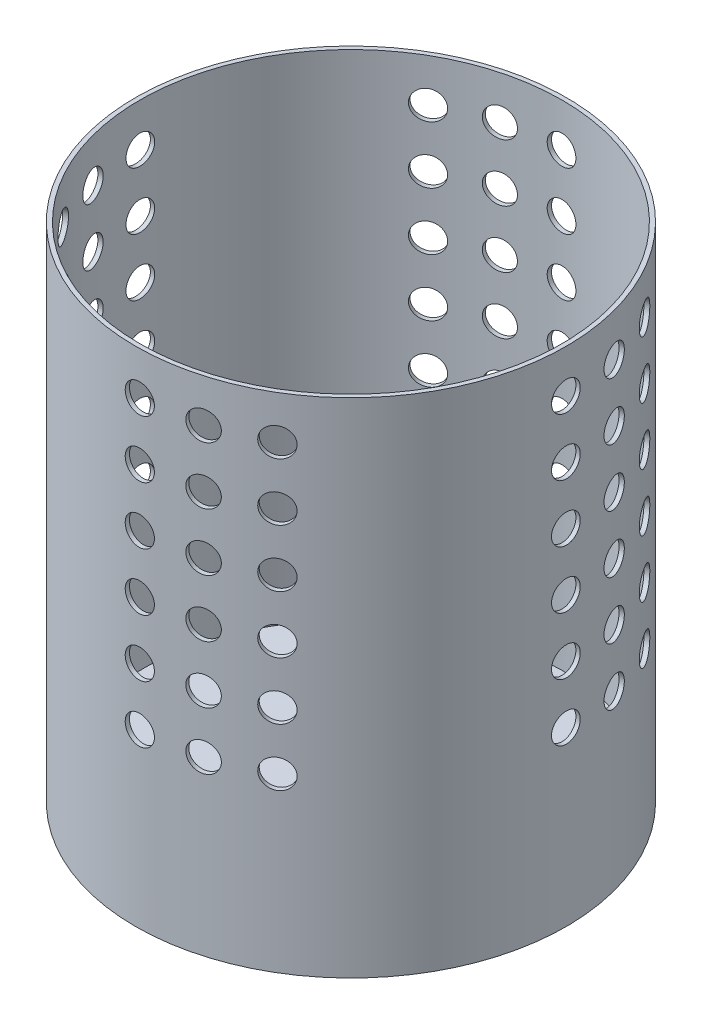
from build123d import *

# Parameters (mm, degrees)
SKETCH1_R                   = 75
BOSS_EXTRUDE1_DEPTH         = 175
SHELL1_T                    = -1.5
SKETCH2_R                   = 5
CUT_EXTRUDE1_DEPTH          = 175
SKETCH3_R                   = 5
CUT_EXTRUDE2_DEPTH          = 5
CIRPATTERN1_COUNT           = 3
CIRPATTERN1_ANGLE           = 30
CIRPATTERN2_COUNT           = 4
CIRPATTERN2_COPY_1_SKETCH_R = 5
CIRPATTERN2_COPY_1_DEPTH    = 5
CIRPATTERN2_COPY_2_SKETCH_R = 5
CIRPATTERN2_COPY_2_DEPTH    = 5
CIRPATTERN2_COPY_3_SKETCH_R = 5
CIRPATTERN2_COPY_3_DEPTH    = 5
CIRPATTERN2_COPY_4_SKETCH_R = 5
CIRPATTERN2_COPY_4_DEPTH    = 5
CIRPATTERN2_COPY_5_SKETCH_R = 5
CIRPATTERN2_COPY_5_DEPTH    = 5
CIRPATTERN2_COPY_6_SKETCH_R = 5
CIRPATTERN2_COPY_6_DEPTH    = 5
CIRPATTERN2_COPY_7_SKETCH_R = 5
CIRPATTERN2_COPY_7_DEPTH    = 5
CIRPATTERN2_COPY_8_SKETCH_R = 5
CIRPATTERN2_COPY_8_DEPTH    = 5
CIRPATTERN2_COPY_9_SKETCH_R = 5
CIRPATTERN2_COPY_9_DEPTH    = 5
SKETCH4_R                   = 73.5
CUT_EXTRUDE3_DEPTH          = 172
CIRPATTERN3_COPY_1_SKETCH_R = 5
CIRPATTERN3_COPY_1_DEPTH    = 5
CIRPATTERN3_COPY_2_SKETCH_R = 5
CIRPATTERN3_COPY_2_DEPTH    = 5
CIRPATTERN3_COPY_3_SKETCH_R = 5
CIRPATTERN3_COPY_3_DEPTH    = 5


with BuildPart() as part:
    # Sketch1 → Boss-Extrude1 (new body)
    with BuildSketch(Plane(origin=(0, 0, 0), x_dir=(1, 0, 0), z_dir=(0, 1, 0))):
        Circle(SKETCH1_R)
    boss_extrude1 = extrude(amount=BOSS_EXTRUDE1_DEPTH)

    # Shell1
    shell1_openings = [part.faces().sort_by_distance(p)[0] for p in [
        (0, 175, 0),
    ]]
    offset(amount=SHELL1_T, openings=shell1_openings, kind=Kind.INTERSECTION)

    # Sketch2 → Cut-Extrude1 (cut)
    with BuildSketch(Plane.XZ):
        Circle(SKETCH2_R)
        with Locations((0, 20)):
            Circle(SKETCH2_R)
        with Locations((0, 40)):
            Circle(SKETCH2_R)
        with Locations((0, 60)):
            Circle(SKETCH2_R)
        with Locations((17.320508076, 10)):
            Circle(SKETCH2_R)
        with Locations((17.320508076, -10)):
            Circle(SKETCH2_R)
        with Locations((0, -20)):
            Circle(SKETCH2_R)
        with Locations((-17.320508076, -10)):
            Circle(SKETCH2_R)
        with Locations((-17.320508076, 10)):
            Circle(SKETCH2_R)
        with Locations((20, 34.641016151)):
            Circle(SKETCH2_R)
        with Locations((34.641016151, 20)):
            Circle(SKETCH2_R)
        with Locations((40, 0)):
            Circle(SKETCH2_R)
        with Locations((34.641016151, -20)):
            Circle(SKETCH2_R)
        with Locations((20, -34.641016151)):
            Circle(SKETCH2_R)
        with Locations((0, -40)):
            Circle(SKETCH2_R)
        with Locations((-20, -34.641016151)):
            Circle(SKETCH2_R)
        with Locations((-34.641016151, -20)):
            Circle(SKETCH2_R)
        with Locations((-40, 0)):
            Circle(SKETCH2_R)
        with Locations((-34.641016151, 20)):
            Circle(SKETCH2_R)
        with Locations((-20, 34.641016151)):
            Circle(SKETCH2_R)
        with Locations((22.961005942, 55.432771951)):
            Circle(SKETCH2_R)
        with Locations((42.426406871, 42.426406871)):
            Circle(SKETCH2_R)
        with Locations((55.432771951, 22.961005942)):
            Circle(SKETCH2_R)
        with Locations((60, 0)):
            Circle(SKETCH2_R)
        with Locations((55.432771951, -22.961005942)):
            Circle(SKETCH2_R)
        with Locations((42.426406871, -42.426406871)):
            Circle(SKETCH2_R)
        with Locations((22.961005942, -55.432771951)):
            Circle(SKETCH2_R)
        with Locations((0, -60)):
            Circle(SKETCH2_R)
        with Locations((-22.961005942, -55.432771951)):
            Circle(SKETCH2_R)
        with Locations((-42.426406871, -42.426406871)):
            Circle(SKETCH2_R)
        with Locations((-55.432771951, -22.961005942)):
            Circle(SKETCH2_R)
        with Locations((-60, 0)):
            Circle(SKETCH2_R)
        with Locations((-55.432771951, 22.961005942)):
            Circle(SKETCH2_R)
        with Locations((-42.426406871, 42.426406871)):
            Circle(SKETCH2_R)
        with Locations((-22.961005942, 55.432771951)):
            Circle(SKETCH2_R)
    extrude(amount=-CUT_EXTRUDE1_DEPTH, mode=Mode.SUBTRACT)

    # Sketch3 → Cut-Extrude2 (cut)
    with BuildSketch(Plane.XY.offset(75)):
        with Locations((0, 160)):
            Circle(SKETCH3_R)
        with Locations((0, 140)):
            Circle(SKETCH3_R)
        with Locations((0, 120)):
            Circle(SKETCH3_R)
        with Locations((0, 100)):
            Circle(SKETCH3_R)
        with Locations((0, 80)):
            Circle(SKETCH3_R)
        with Locations((0, 60)):
            Circle(SKETCH3_R)
    cut_extrude2 = extrude(amount=-CUT_EXTRUDE2_DEPTH, mode=Mode.SUBTRACT)

    # CirPattern1: Cut-Extrude2 ×3 about axis
    cirpattern1_axis = Axis((0, 175, 0), (0, 1, 0))
    for i in range(1, CIRPATTERN1_COUNT):
        add(cut_extrude2.rotate(cirpattern1_axis, i * CIRPATTERN1_ANGLE / (CIRPATTERN1_COUNT - 1)), mode=Mode.SUBTRACT)

    # CirPattern2: Boss-Extrude1 ×4 about axis
    cirpattern2_axis = Axis((0, 175, 0), (0, 1, 0))
    for i in range(1, CIRPATTERN2_COUNT):
        add(boss_extrude1.rotate(cirpattern2_axis, i * 360 / CIRPATTERN2_COUNT))

    # CirPattern2 copy 1 sketch → CirPattern2 copy 1 (cut)
    with BuildSketch(Plane(origin=(72.444436972, 0, -19.411428383), x_dir=(-0.25881904510252135, 0, -0.9659258262890681), z_dir=(0.9659258262890681, 0, -0.25881904510252135))):
        with Locations((0, 160)):
            Circle(CIRPATTERN2_COPY_1_SKETCH_R)
        with Locations((0, 140)):
            Circle(CIRPATTERN2_COPY_1_SKETCH_R)
        with Locations((0, 120)):
            Circle(CIRPATTERN2_COPY_1_SKETCH_R)
        with Locations((0, 100)):
            Circle(CIRPATTERN2_COPY_1_SKETCH_R)
        with Locations((0, 80)):
            Circle(CIRPATTERN2_COPY_1_SKETCH_R)
        with Locations((0, 60)):
            Circle(CIRPATTERN2_COPY_1_SKETCH_R)
    extrude(amount=-CIRPATTERN2_COPY_1_DEPTH, mode=Mode.SUBTRACT)

    # CirPattern2 copy 2 sketch → CirPattern2 copy 2 (cut)
    with BuildSketch(Plane(origin=(-19.411428383, 0, -72.444436972), x_dir=(-0.9659258262890681, 0, 0.2588190451025213), z_dir=(-0.2588190451025213, 0, -0.9659258262890681))):
        with Locations((0, 160)):
            Circle(CIRPATTERN2_COPY_2_SKETCH_R)
        with Locations((0, 140)):
            Circle(CIRPATTERN2_COPY_2_SKETCH_R)
        with Locations((0, 120)):
            Circle(CIRPATTERN2_COPY_2_SKETCH_R)
        with Locations((0, 100)):
            Circle(CIRPATTERN2_COPY_2_SKETCH_R)
        with Locations((0, 80)):
            Circle(CIRPATTERN2_COPY_2_SKETCH_R)
        with Locations((0, 60)):
            Circle(CIRPATTERN2_COPY_2_SKETCH_R)
    extrude(amount=-CIRPATTERN2_COPY_2_DEPTH, mode=Mode.SUBTRACT)

    # CirPattern2 copy 3 sketch → CirPattern2 copy 3 (cut)
    with BuildSketch(Plane(origin=(-72.444436972, 0, 19.411428383), x_dir=(0.25881904510252124, 0, 0.9659258262890681), z_dir=(-0.9659258262890681, 0, 0.25881904510252124))):
        with Locations((0, 160)):
            Circle(CIRPATTERN2_COPY_3_SKETCH_R)
        with Locations((0, 140)):
            Circle(CIRPATTERN2_COPY_3_SKETCH_R)
        with Locations((0, 120)):
            Circle(CIRPATTERN2_COPY_3_SKETCH_R)
        with Locations((0, 100)):
            Circle(CIRPATTERN2_COPY_3_SKETCH_R)
        with Locations((0, 80)):
            Circle(CIRPATTERN2_COPY_3_SKETCH_R)
        with Locations((0, 60)):
            Circle(CIRPATTERN2_COPY_3_SKETCH_R)
    extrude(amount=-CIRPATTERN2_COPY_3_DEPTH, mode=Mode.SUBTRACT)

    # CirPattern2 copy 4 sketch → CirPattern2 copy 4 (cut)
    with BuildSketch(Plane(origin=(64.951905284, 0, -37.5), x_dir=(-0.5000000000000011, 0, -0.866025403784438), z_dir=(0.866025403784438, 0, -0.5000000000000011))):
        with Locations((0, 160)):
            Circle(CIRPATTERN2_COPY_4_SKETCH_R)
        with Locations((0, 140)):
            Circle(CIRPATTERN2_COPY_4_SKETCH_R)
        with Locations((0, 120)):
            Circle(CIRPATTERN2_COPY_4_SKETCH_R)
        with Locations((0, 100)):
            Circle(CIRPATTERN2_COPY_4_SKETCH_R)
        with Locations((0, 80)):
            Circle(CIRPATTERN2_COPY_4_SKETCH_R)
        with Locations((0, 60)):
            Circle(CIRPATTERN2_COPY_4_SKETCH_R)
    extrude(amount=-CIRPATTERN2_COPY_4_DEPTH, mode=Mode.SUBTRACT)

    # CirPattern2 copy 5 sketch → CirPattern2 copy 5 (cut)
    with BuildSketch(Plane(origin=(-37.5, 0, -64.951905284), x_dir=(-0.8660254037844382, 0, 0.500000000000001), z_dir=(-0.500000000000001, 0, -0.8660254037844382))):
        with Locations((0, 160)):
            Circle(CIRPATTERN2_COPY_5_SKETCH_R)
        with Locations((0, 140)):
            Circle(CIRPATTERN2_COPY_5_SKETCH_R)
        with Locations((0, 120)):
            Circle(CIRPATTERN2_COPY_5_SKETCH_R)
        with Locations((0, 100)):
            Circle(CIRPATTERN2_COPY_5_SKETCH_R)
        with Locations((0, 80)):
            Circle(CIRPATTERN2_COPY_5_SKETCH_R)
        with Locations((0, 60)):
            Circle(CIRPATTERN2_COPY_5_SKETCH_R)
    extrude(amount=-CIRPATTERN2_COPY_5_DEPTH, mode=Mode.SUBTRACT)

    # CirPattern2 copy 6 sketch → CirPattern2 copy 6 (cut)
    with BuildSketch(Plane(origin=(-64.951905284, 0, 37.5), x_dir=(0.500000000000001, 0, 0.8660254037844382), z_dir=(-0.8660254037844382, 0, 0.500000000000001))):
        with Locations((0, 160)):
            Circle(CIRPATTERN2_COPY_6_SKETCH_R)
        with Locations((0, 140)):
            Circle(CIRPATTERN2_COPY_6_SKETCH_R)
        with Locations((0, 120)):
            Circle(CIRPATTERN2_COPY_6_SKETCH_R)
        with Locations((0, 100)):
            Circle(CIRPATTERN2_COPY_6_SKETCH_R)
        with Locations((0, 80)):
            Circle(CIRPATTERN2_COPY_6_SKETCH_R)
        with Locations((0, 60)):
            Circle(CIRPATTERN2_COPY_6_SKETCH_R)
    extrude(amount=-CIRPATTERN2_COPY_6_DEPTH, mode=Mode.SUBTRACT)

    # CirPattern2 copy 7 sketch → CirPattern2 copy 7 (cut)
    with BuildSketch(Plane(origin=(75, 0, 0), x_dir=(0, 0, -1), z_dir=(1, 0, 0))):
        with Locations((0, 160)):
            Circle(CIRPATTERN2_COPY_7_SKETCH_R)
        with Locations((0, 140)):
            Circle(CIRPATTERN2_COPY_7_SKETCH_R)
        with Locations((0, 120)):
            Circle(CIRPATTERN2_COPY_7_SKETCH_R)
        with Locations((0, 100)):
            Circle(CIRPATTERN2_COPY_7_SKETCH_R)
        with Locations((0, 80)):
            Circle(CIRPATTERN2_COPY_7_SKETCH_R)
        with Locations((0, 60)):
            Circle(CIRPATTERN2_COPY_7_SKETCH_R)
    extrude(amount=-CIRPATTERN2_COPY_7_DEPTH, mode=Mode.SUBTRACT)

    # CirPattern2 copy 8 sketch → CirPattern2 copy 8 (cut)
    with BuildSketch(Plane(origin=(0, 0, -75), x_dir=(-1, 0, 0), z_dir=(0, 0, -1))):
        with Locations((0, 160)):
            Circle(CIRPATTERN2_COPY_8_SKETCH_R)
        with Locations((0, 140)):
            Circle(CIRPATTERN2_COPY_8_SKETCH_R)
        with Locations((0, 120)):
            Circle(CIRPATTERN2_COPY_8_SKETCH_R)
        with Locations((0, 100)):
            Circle(CIRPATTERN2_COPY_8_SKETCH_R)
        with Locations((0, 80)):
            Circle(CIRPATTERN2_COPY_8_SKETCH_R)
        with Locations((0, 60)):
            Circle(CIRPATTERN2_COPY_8_SKETCH_R)
    extrude(amount=-CIRPATTERN2_COPY_8_DEPTH, mode=Mode.SUBTRACT)

    # CirPattern2 copy 9 sketch → CirPattern2 copy 9 (cut)
    with BuildSketch(Plane.ZY.offset(75)):
        with Locations((0, 160)):
            Circle(CIRPATTERN2_COPY_9_SKETCH_R)
        with Locations((0, 140)):
            Circle(CIRPATTERN2_COPY_9_SKETCH_R)
        with Locations((0, 120)):
            Circle(CIRPATTERN2_COPY_9_SKETCH_R)
        with Locations((0, 100)):
            Circle(CIRPATTERN2_COPY_9_SKETCH_R)
        with Locations((0, 80)):
            Circle(CIRPATTERN2_COPY_9_SKETCH_R)
        with Locations((0, 60)):
            Circle(CIRPATTERN2_COPY_9_SKETCH_R)
    extrude(amount=-CIRPATTERN2_COPY_9_DEPTH, mode=Mode.SUBTRACT)

    # Sketch4 → Cut-Extrude3 (cut)
    with BuildSketch(Plane(origin=(0, 175, 0), x_dir=(1, 0, 0), z_dir=(0, 1, 0))):
        Circle(SKETCH4_R)
    extrude(amount=-CUT_EXTRUDE3_DEPTH, mode=Mode.SUBTRACT)

    # CirPattern3 copy 1 sketch → CirPattern3 copy 1 (cut)
    with BuildSketch(Plane(origin=(20.672801686, 0, 72.094627195), x_dir=(0.9612616959383186, 0, -0.27563735581700044), z_dir=(0.27563735581700044, 0, 0.9612616959383186))):
        with Locations((0, 160)):
            Circle(CIRPATTERN3_COPY_1_SKETCH_R)
        with Locations((0, 140)):
            Circle(CIRPATTERN3_COPY_1_SKETCH_R)
        with Locations((0, 120)):
            Circle(CIRPATTERN3_COPY_1_SKETCH_R)
        with Locations((0, 100)):
            Circle(CIRPATTERN3_COPY_1_SKETCH_R)
        with Locations((0, 80)):
            Circle(CIRPATTERN3_COPY_1_SKETCH_R)
        with Locations((0, 60)):
            Circle(CIRPATTERN3_COPY_1_SKETCH_R)
    extrude(amount=-CIRPATTERN3_COPY_1_DEPTH, mode=Mode.SUBTRACT)

    # CirPattern3 copy 2 sketch → CirPattern3 copy 2 (cut)
    with BuildSketch(Plane(origin=(38.627855618, 0, 64.287547553), x_dir=(0.8571673007021114, 0, -0.5150380749100558), z_dir=(0.5150380749100558, 0, 0.8571673007021114))):
        with Locations((0, 160)):
            Circle(CIRPATTERN3_COPY_2_SKETCH_R)
        with Locations((0, 140)):
            Circle(CIRPATTERN3_COPY_2_SKETCH_R)
        with Locations((0, 120)):
            Circle(CIRPATTERN3_COPY_2_SKETCH_R)
        with Locations((0, 100)):
            Circle(CIRPATTERN3_COPY_2_SKETCH_R)
        with Locations((0, 80)):
            Circle(CIRPATTERN3_COPY_2_SKETCH_R)
        with Locations((0, 60)):
            Circle(CIRPATTERN3_COPY_2_SKETCH_R)
    extrude(amount=-CIRPATTERN3_COPY_2_DEPTH, mode=Mode.SUBTRACT)

    # CirPattern3 copy 3 sketch → CirPattern3 copy 3 (cut)
    with BuildSketch(Plane(origin=(1.308930483, 0, 74.988577137), x_dir=(0.9998476951563913, 0, -0.01745240643728413), z_dir=(0.01745240643728413, 0, 0.9998476951563913))):
        with Locations((0, 160)):
            Circle(CIRPATTERN3_COPY_3_SKETCH_R)
        with Locations((0, 140)):
            Circle(CIRPATTERN3_COPY_3_SKETCH_R)
        with Locations((0, 120)):
            Circle(CIRPATTERN3_COPY_3_SKETCH_R)
        with Locations((0, 100)):
            Circle(CIRPATTERN3_COPY_3_SKETCH_R)
        with Locations((0, 80)):
            Circle(CIRPATTERN3_COPY_3_SKETCH_R)
        with Locations((0, 60)):
            Circle(CIRPATTERN3_COPY_3_SKETCH_R)
    extrude(amount=-CIRPATTERN3_COPY_3_DEPTH, mode=Mode.SUBTRACT)


solid = part.part
